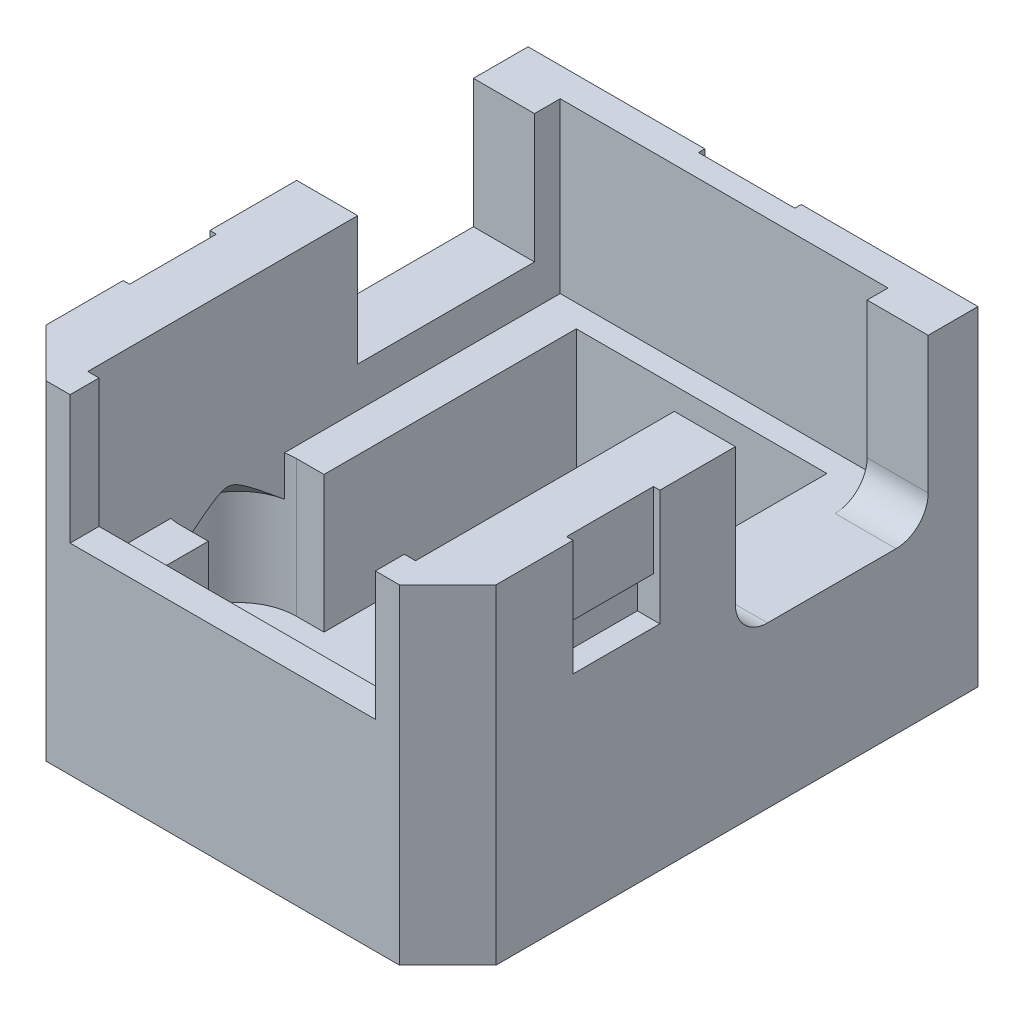
from build123d import *

# Parameters (mm, degrees)
SZKIC1_W                    = 28
SZKIC1_H                    = 33
DODANIE_WYCI_GNI_CIE1_DEPTH = 1.5
SZKIC2_W                    = 28
SZKIC2_H                    = 33
SZKIC2_W_2                  = 20.4
SZKIC2_H_2                  = 29.4
DODANIE_WYCI_GNI_CIE2_DEPTH = 19
SZKIC7_W                    = 20.4
SZKIC7_H                    = 29.4
SZKIC7_W_2                  = 15.6
SZKIC7_H_2                  = 26.6
DODANIE_WYCI_GNI_CIE4_DEPTH = 8.5
SZKIC3_W                    = 12
SZKIC3_H                    = 10.5
WYTNIJ_WYCI_GNI_CIE1_DEPTH  = 3.8
SZKIC4_W                    = 19
SZKIC4_H                    = 8
WYTNIJ_WYCI_GNI_CIE2_DEPTH  = 1.8
SZKIC5_W                    = 11
SZKIC5_H                    = 8
WYTNIJ_WYCI_GNI_CIE3_DEPTH  = 3.8
WYTNIJ_WYCI_GNI_CIE4_START  = -10
WYTNIJ_WYCI_GNI_CIE4_DEPTH  = 10
WYTNIJ_WYCI_GNI_CIE8_START  = -1.5
WYTNIJ_WYCI_GNI_CIE8_DEPTH  = 8.5
ZAOKR_GLENIE1_R             = 2
SZKIC10_W                   = 5.4
SZKIC10_H                   = 7.2
WYTNIJ_WYCI_GNI_CIE9_DEPTH  = 0.4
SZKIC11_W                   = 5.4
SZKIC11_H                   = 2.5
WYTNIJ_WYCI_GNI_CIE10_DEPTH = 1
SZKIC12_W                   = 6
SZKIC12_H                   = 7.2
WYTNIJ_WYCI_GNI_CIE11_DEPTH = 0.4
SZKIC13_W                   = 6
SZKIC13_H                   = 2.5
WYTNIJ_WYCI_GNI_CIE12_DEPTH = 1
SFAZOWANIE1_SIZE            = 1
SFAZOWANIE2_SIZE            = 3
SFAZOWANIE3_SIZE            = 2.5
SFAZOWANIE3_SIZE_2          = 2.979383981


# Some blends are built 0.0001 mm under size
with BuildPart() as part:
    # Szkic1 → Dodanie-wyciągnięcie1 (new body)
    with BuildSketch(Plane(origin=(0, 0, 0), x_dir=(1, 0, 0), z_dir=(0, 1, 0))):
        Rectangle(SZKIC1_W, SZKIC1_H)
    extrude(amount=DODANIE_WYCI_GNI_CIE1_DEPTH)

    # Szkic2 → Dodanie-wyciągnięcie2 (add)
    with BuildSketch(Plane(origin=(0, 1.5, 0), x_dir=(1, 0, 0), z_dir=(0, 1, 0))):
        Rectangle(SZKIC2_W, SZKIC2_H)
        Rectangle(SZKIC2_W_2, SZKIC2_H_2, mode=Mode.SUBTRACT)
    extrude(amount=DODANIE_WYCI_GNI_CIE2_DEPTH)

    # Szkic7 → Dodanie-wyciągnięcie4 (add)
    with BuildSketch(Plane(origin=(0, 1.5, 0), x_dir=(1, 0, 0), z_dir=(0, 1, 0))):
        Rectangle(SZKIC7_W, SZKIC7_H)
        Rectangle(SZKIC7_W_2, SZKIC7_H_2, mode=Mode.SUBTRACT)
    extrude(amount=DODANIE_WYCI_GNI_CIE4_DEPTH)

    # Szkic3 → Wytnij-wyciągnięcie1 (cut)
    with BuildSketch(Plane(origin=(14, 0, 0), x_dir=(0, 0, -1), z_dir=(1, 0, 0))):
        with Locations((7.4, 15.25)):
            Rectangle(SZKIC3_W, SZKIC3_H)
    extrude(amount=-WYTNIJ_WYCI_GNI_CIE1_DEPTH, mode=Mode.SUBTRACT)

    # Szkic4 → Wytnij-wyciągnięcie2 (cut)
    with BuildSketch(Plane.XY.offset(16.5)):
        with Locations((0, 16.5)):
            Rectangle(SZKIC4_W, SZKIC4_H)
    extrude(amount=-WYTNIJ_WYCI_GNI_CIE2_DEPTH, mode=Mode.SUBTRACT)

    # Szkic5 → Wytnij-wyciągnięcie3 (cut)
    with BuildSketch(Plane.ZY.offset(14)):
        with Locations((-7.6, 16.5)):
            Rectangle(SZKIC5_W, SZKIC5_H)
    extrude(amount=-WYTNIJ_WYCI_GNI_CIE3_DEPTH, mode=Mode.SUBTRACT)

    # Szkic8 → Wytnij-wyciągnięcie4 (cut)
    with BuildSketch(Plane.XZ.offset(WYTNIJ_WYCI_GNI_CIE4_START)):
        with BuildLine():
            Line((9.5, 4.35), (4.5, 4.35))
            ThreePointArc((4.5, 4.35), (2.85, 6), (4.5, 7.65))
            Line((4.5, 7.65), (9.5, 7.65))
            ThreePointArc((9.5, 7.65), (11.15, 6), (9.5, 4.35))
        make_face()
        with BuildLine():
            Line((-9.5, 4.35), (-4.5, 4.35))
            ThreePointArc((-4.5, 4.35), (-2.85, 6), (-4.5, 7.65))
            Line((-4.5, 7.65), (-9.5, 7.65))
            ThreePointArc((-9.5, 7.65), (-11.15, 6), (-9.5, 4.35))
        make_face()
    extrude(amount=WYTNIJ_WYCI_GNI_CIE4_DEPTH, mode=Mode.SUBTRACT)

    # Szkic9 → Wytnij-wyciągnięcie8 (cut)
    with BuildSketch(Plane.XZ.offset(WYTNIJ_WYCI_GNI_CIE8_START)):
        with BuildLine():
            Line((-9.5, 2.4), (-5.001731613, 2.4))
            Line((-5.001731613, 2.4), (-5.001731613, 9.6))
            Line((-5.001731613, 9.6), (-9.5, 9.6))
            ThreePointArc((-9.5, 9.6), (-13.1, 6), (-9.5, 2.4))
        make_face()
        with BuildLine():
            Line((5.001731613, 9.6), (9.5, 9.6))
            ThreePointArc((9.5, 9.6), (13.1, 6), (9.5, 2.4))
            Line((9.5, 2.4), (5.001731613, 2.4))
            Line((5.001731613, 2.4), (5.001731613, 9.6))
        make_face()
    extrude(amount=-WYTNIJ_WYCI_GNI_CIE8_DEPTH, mode=Mode.SUBTRACT)

    # Zaokrąglenie1
    zaokr_glenie1_edges = [part.edges().sort_by_distance(p)[0] for p in [
        (12.1, 10, -13.4),
        (12.1, 10, -1.4),
    ]]
    fillet(zaokr_glenie1_edges, radius=ZAOKR_GLENIE1_R)

    # Szkic10 → Wytnij-wyciągnięcie9 (cut)
    with BuildSketch(Plane(origin=(14, 0, 0), x_dir=(0, 0, -1), z_dir=(1, 0, 0))):
        with Locations((-6, 16.9)):
            Rectangle(SZKIC10_W, SZKIC10_H)
    wytnij_wyci_gni_cie9 = extrude(amount=-WYTNIJ_WYCI_GNI_CIE9_DEPTH, mode=Mode.SUBTRACT)

    # Szkic11 → Wytnij-wyciągnięcie10 (cut)
    with BuildSketch(Plane(origin=(13.6, 0, 0), x_dir=(0, 0, -1), z_dir=(1, 0, 0))):
        with Locations((-6, 14.55)):
            Rectangle(SZKIC11_W, SZKIC11_H)
    wytnij_wyci_gni_cie10 = extrude(amount=-WYTNIJ_WYCI_GNI_CIE10_DEPTH, mode=Mode.SUBTRACT)

    # Szkic12 → Wytnij-wyciągnięcie11 (cut)
    with BuildSketch(Plane(origin=(0, 0, -16.5), x_dir=(-1, 0, 0), z_dir=(0, 0, -1))):
        with Locations((0, 16.9)):
            Rectangle(SZKIC12_W, SZKIC12_H)
    extrude(amount=-WYTNIJ_WYCI_GNI_CIE11_DEPTH, mode=Mode.SUBTRACT)

    # Szkic13 → Wytnij-wyciągnięcie12 (cut)
    with BuildSketch(Plane(origin=(0, 0, -16.1), x_dir=(-1, 0, 0), z_dir=(0, 0, -1))):
        with Locations((0, 14.55)):
            Rectangle(SZKIC13_W, SZKIC13_H)
    extrude(amount=-WYTNIJ_WYCI_GNI_CIE12_DEPTH, mode=Mode.SUBTRACT)

    # Lustro1: Wytnij-wyciągnięcie9, Wytnij-wyciągnięcie10 across plane
    add(wytnij_wyci_gni_cie9.mirror(Plane(origin=(0, 0, 0), x_dir=(0, 0, 1), z_dir=(1, 0, 0))), mode=Mode.SUBTRACT)
    add(wytnij_wyci_gni_cie10.mirror(Plane(origin=(0, 0, 0), x_dir=(0, 0, 1), z_dir=(1, 0, 0))), mode=Mode.SUBTRACT)

    # Sfazowanie1
    sfazowanie1_edges = [part.edges().sort_by_distance(p)[0] for p in [
        (12.6, 15.8, 6),
        (0, 15.8, -15.1),
        (-12.6, 15.8, 6),
    ]]
    chamfer(sfazowanie1_edges, length=SFAZOWANIE1_SIZE - 0.0001)  # a hair under: the kernel refuses the full size

    # Sfazowanie2
    sfazowanie2_edges = [part.edges().sort_by_distance(p)[0] for p in [
        (14, 10.25, 16.5),
        (-14, 10.25, 16.5),
    ]]
    chamfer(sfazowanie2_edges, length=SFAZOWANIE2_SIZE)

    # Sfazowanie3
    # the kernel refuses this chamfer: 2.979383981, 2.5 mm, written as the material it adds along each edge
    with BuildSketch(Plane(origin=(9.5, 10, 6), x_dir=(-0.9999950652018581, 0, 0.0031415874858795353), z_dir=(-0.0031415874858795353, 0, -0.9999950652018581))) as sfazowanie3_piece_1_section:
        Polygon((3.6, -SFAZOWANIE3_SIZE), (3.6 - SFAZOWANIE3_SIZE_2, 0), (3.6, 0), align=None)
    sfazowanie3_piece_1 = revolve(axis=Axis((9.5, 10, 6), (0, 1, 0)), revolution_arc=359.64, mode=Mode.PRIVATE)
    sfazowanie3_piece_1 = split(sfazowanie3_piece_1, bisect_by=Plane(origin=(10.2, 9.026977163, 6), z_dir=(1, 0, 0)), keep=Keep.TOP, mode=Mode.PRIVATE)
    add(sfazowanie3_piece_1)
    with BuildSketch(Plane(origin=(-9.5, 10, 6), x_dir=(0.9999950652018581, 0, 0.003141587485879782), z_dir=(0.003141587485879782, 0, -0.9999950652018581))) as sfazowanie3_piece_2_section:
        Polygon((3.6 - SFAZOWANIE3_SIZE_2, 0), (3.6, SFAZOWANIE3_SIZE), (3.6, 0), align=None)
    sfazowanie3_piece_2 = revolve(axis=Axis((-9.5, 10, 6), (0, -1, 0)), revolution_arc=359.64, mode=Mode.PRIVATE)
    sfazowanie3_piece_2 = split(sfazowanie3_piece_2, bisect_by=Plane(origin=(-10.2, 9.026977163, 6.000000001), z_dir=(-1, 0, 0)), keep=Keep.TOP, mode=Mode.PRIVATE)
    add(sfazowanie3_piece_2)


solid = part.part
